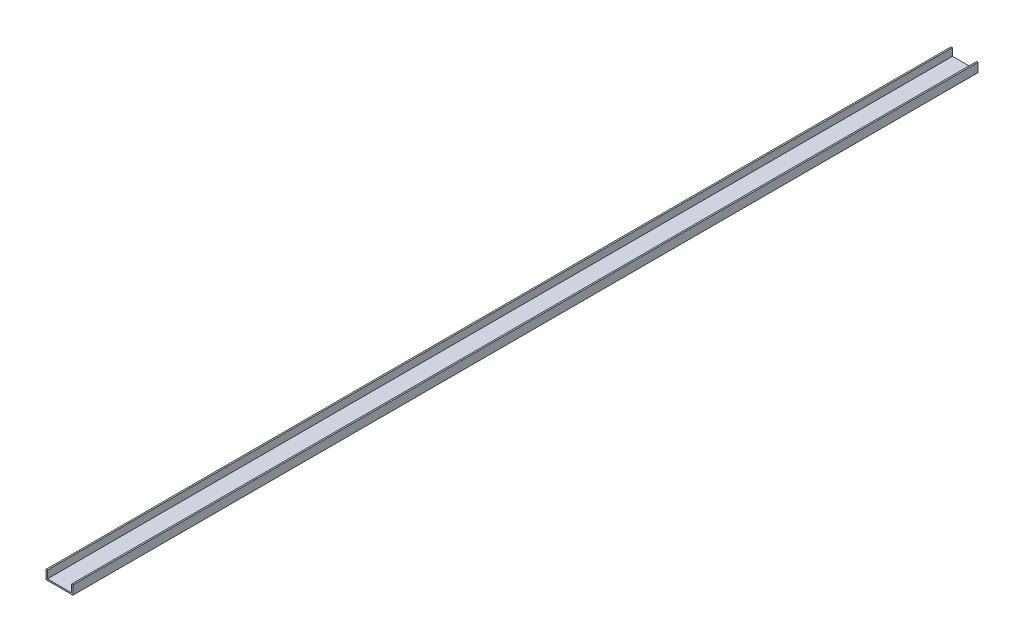
from build123d import *

# Parameters (mm, degrees)
BOSS_EXTRUDE1_DEPTH = 5124.45


with BuildPart() as part:
    # Sketch3 → Boss-Extrude1 (new body)
    with BuildSketch(Plane.XY):
        Polygon((-68.2625, 42.8625), (-68.2625, 0), (68.2625, 0), (68.2625, 42.8625), (76.2, 42.8625), (76.2, -7.9375), (-76.2, -7.9375), (-76.2, 42.8625), align=None)
    extrude(amount=BOSS_EXTRUDE1_DEPTH)


solid = part.part
